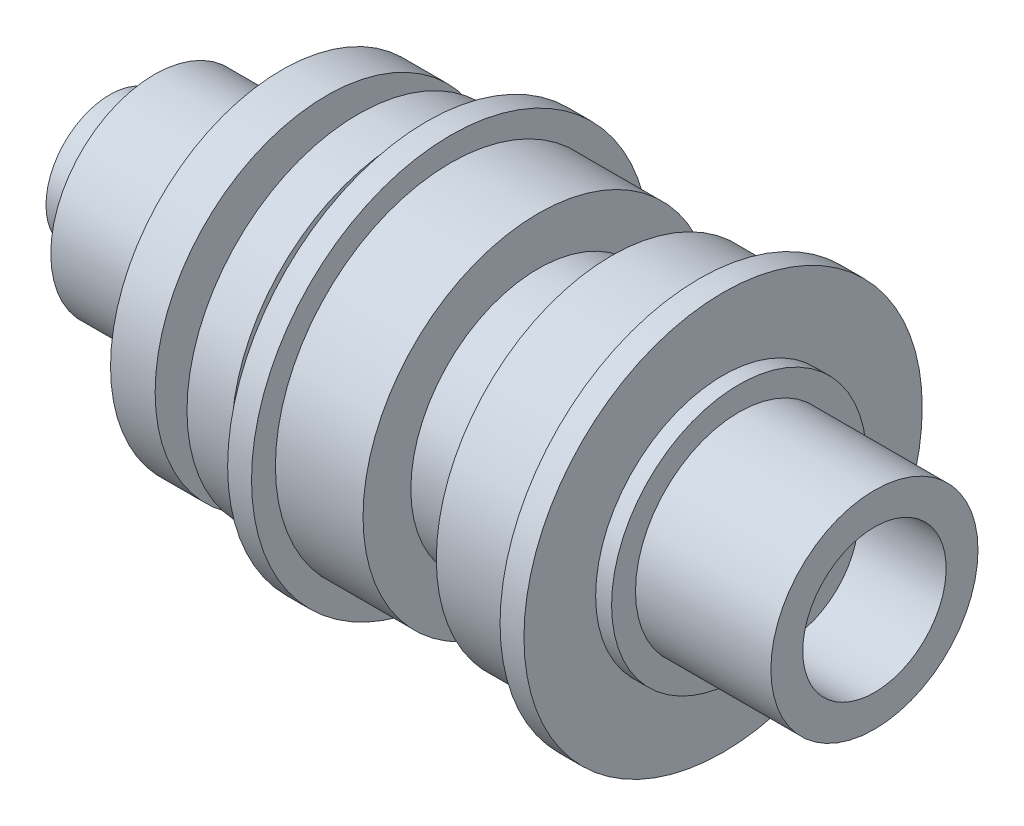
from build123d import *


with BuildPart() as part:
    # Sketch1 → Revolve1 (revolve)
    with BuildSketch(Plane.XY):
        Polygon((10.8, 6.5), (2.8, 6.5), (2.8, 4), (0, 4), (0, 0), (42.5, 0), (42.5, 4.5), (48, 4.5), (48, 6.5), (39.5, 6.5), (39.5, 8), (38.5, 8), (38.5, 12.5), (37, 12.5), (37, 11), (31.5, 11), (31.5, 8), (26.9, 8), (26.9, 11), (21.4, 11), (21.4, 12.5), (19.9, 12.5), (19.9, 8), (18.4, 8), (18.4, 10.75), (15.6, 10.75), (15.6, 4), (13.6, 4), (13.6, 10.75), (10.8, 10.75), align=None)
    revolve(axis=Axis((-10.695200226, 0, 0), (1, 0, 0)))


solid = part.part
